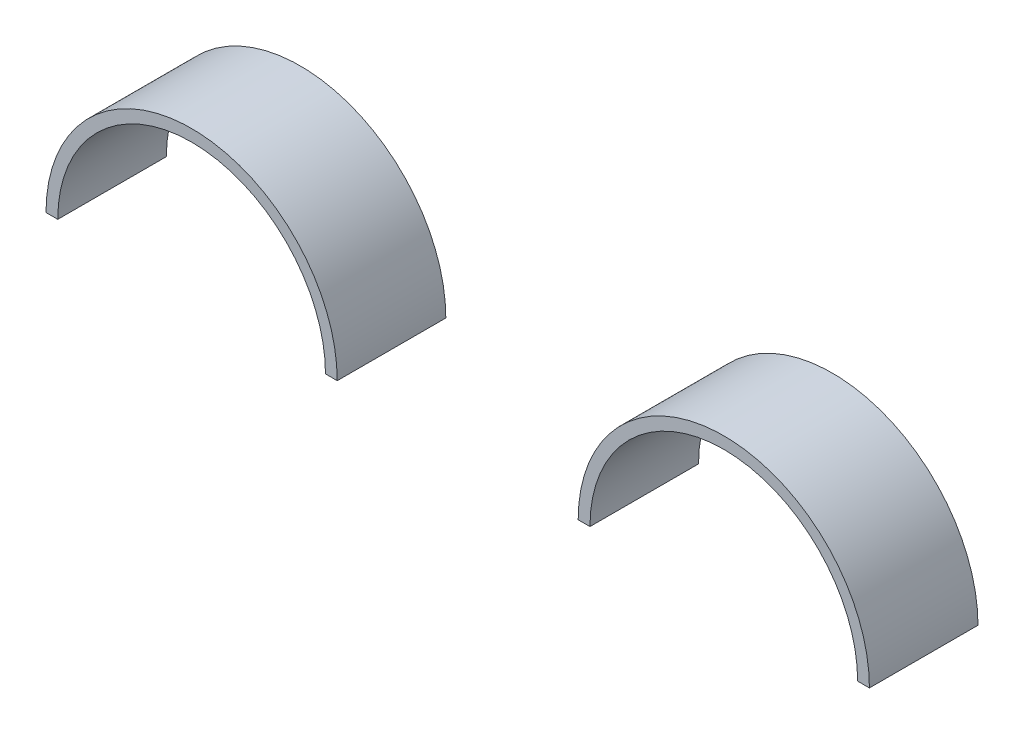
from build123d import *

# Parameters (mm, degrees)
BOSS_EXTRUDE1_DEPTH   = 40.56
BOSS_EXTRUDE1_2_DEPTH = 40.56


with BuildPart() as part:
    # Sketch1 → Boss-Extrude1 (new body)
    with BuildSketch(Plane(origin=(0, 0, 563.242336202), x_dir=(0, -1, 0), z_dir=(0, 0, -1))):
        with BuildLine():
            Line((326.790615215, -1394.880472759), (326.790615215, -1399.280472759))
            ThreePointArc((326.790615215, -1399.280472759), (276.790615215, -1449.280472759), (326.790615215, -1499.280472759))
            Line((326.790615215, -1499.280472759), (326.790615215, -1503.680472759))
            ThreePointArc((326.790615215, -1503.680472759), (272.390615215, -1449.280472759), (326.790615215, -1394.880472759))
        make_face()
    extrude(amount=BOSS_EXTRUDE1_DEPTH)


with BuildPart() as body_2:
    # Sketch1 → Boss-Extrude1 2 (new body)
    with BuildSketch(Plane(origin=(0, 0, 563.242336202), x_dir=(0, -1, 0), z_dir=(0, 0, -1))):
        with BuildLine():
            Line((326.790615215, -1698.080472759), (326.790615215, -1702.480472759))
            ThreePointArc((326.790615215, -1702.480472759), (272.390615215, -1648.080472759), (326.790615215, -1593.680472759))
            Line((326.790615215, -1593.680472759), (326.790615215, -1598.080472759))
            ThreePointArc((326.790615215, -1598.080472759), (276.790615215, -1648.080472759), (326.790615215, -1698.080472759))
        make_face()
    extrude(amount=BOSS_EXTRUDE1_2_DEPTH)


solid = Compound([part.part, body_2.part])
